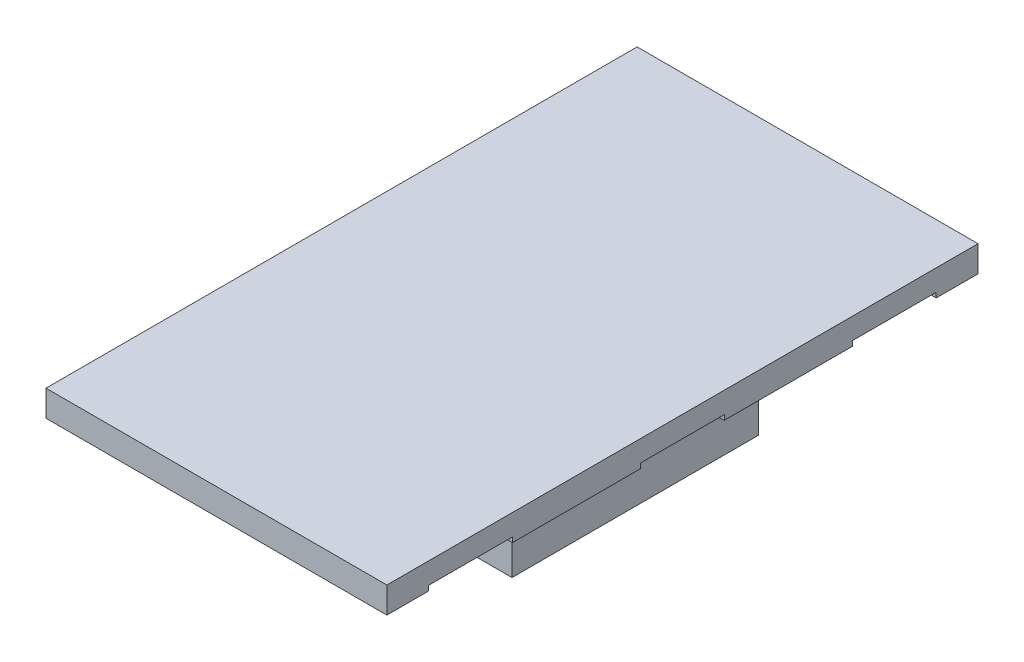
from build123d import *

# Parameters (mm, degrees)
SKETCH1_W           = 6.92
SKETCH1_H           = 12
BOSS_EXTRUDE1_DEPTH = 0.53
SKETCH2_W           = 5
SKETCH2_H           = 5
BOSS_EXTRUDE2_DEPTH = 1.57
SKETCH3_R           = 2
CUT_EXTRUDE1_DEPTH  = 0.2
CHAMFER1_SIZE       = 0.1
SKETCH6_W           = 2
SKETCH6_H           = 1.2
BOSS_EXTRUDE3_DEPTH = 0.45
CUT_EXTRUDE2_DEPTH  = 0.1


with BuildPart() as part:
    # Sketch1 → Boss-Extrude1 (new body)
    with BuildSketch(Plane(origin=(0, 0, 0), x_dir=(1, 0, 0), z_dir=(0, 1, 0))):
        Rectangle(SKETCH1_W, SKETCH1_H)
    extrude(amount=BOSS_EXTRUDE1_DEPTH)

    # Sketch2 → Boss-Extrude2 (add)
    with BuildSketch(Plane.XZ):
        Rectangle(SKETCH2_W, SKETCH2_H)
    extrude(amount=BOSS_EXTRUDE2_DEPTH)

    # Sketch3 → Cut-Extrude1 (cut)
    with BuildSketch(Plane.XZ.offset(1.57)):
        Circle(SKETCH3_R)
    extrude(amount=-CUT_EXTRUDE1_DEPTH, mode=Mode.SUBTRACT)

    # Chamfer1
    chamfer1_edges = [part.edges().sort_by_distance(p)[0] for p in [
        (-2, -1.57, 0),
    ]]
    chamfer(chamfer1_edges, length=CHAMFER1_SIZE)

    # Sketch6 → Boss-Extrude3 (add)
    with BuildSketch(Plane.XZ):
        with Locations((0, -4.25)):
            Rectangle(SKETCH6_W, SKETCH6_H)
    extrude(amount=BOSS_EXTRUDE3_DEPTH)

    # Sketch4 → Cut-Extrude2 (cut)
    with BuildSketch(Plane.XZ):
        with BuildLine():
            Line((3.46, 0.85), (3.46, -0.85))
            ThreePointArc((3.46, -0.85), (2.61, 0), (3.46, 0.85))
        make_face()
        with BuildLine():
            Line((3.46, 5.151541621), (2.351035145, 5.151541621))
            ThreePointArc((2.351035145, 5.151541621), (1.501035145, 4.301541621), (2.351035145, 3.451541621))
            Line((2.351035145, 3.451541621), (3.46, 3.451541621))
            Line((3.46, 3.451541621), (3.46, 5.151541621))
        make_face()
        with BuildLine():
            Line((3.46, -5.151541621), (2.351035145, -5.151541621))
            ThreePointArc((2.351035145, -5.151541621), (1.501035145, -4.301541621), (2.351035145, -3.451541621))
            Line((2.351035145, -3.451541621), (3.46, -3.451541621))
            Line((3.46, -3.451541621), (3.46, -5.151541621))
        make_face()
        with BuildLine():
            Line((-2.351035145, -3.451541621), (-3.46, -3.451541621))
            Line((-3.46, -3.451541621), (-3.46, -5.151541621))
            Line((-3.46, -5.151541621), (-2.351035145, -5.151541621))
            ThreePointArc((-2.351035145, -5.151541621), (-1.501035145, -4.301541621), (-2.351035145, -3.451541621))
        make_face()
        with BuildLine():
            Line((-3.46, 3.451541621), (-3.46, 5.151541621))
            Line((-3.46, 5.151541621), (-2.351035145, 5.151541621))
            ThreePointArc((-2.351035145, 5.151541621), (-1.501035145, 4.301541621), (-2.351035145, 3.451541621))
            Line((-2.351035145, 3.451541621), (-3.46, 3.451541621))
        make_face()
        with BuildLine():
            Line((-3.46, 0.85), (-3.46, -0.85))
            ThreePointArc((-3.46, -0.85), (-2.61, 0), (-3.46, 0.85))
        make_face()
    extrude(amount=-CUT_EXTRUDE2_DEPTH, mode=Mode.SUBTRACT)


solid = part.part
